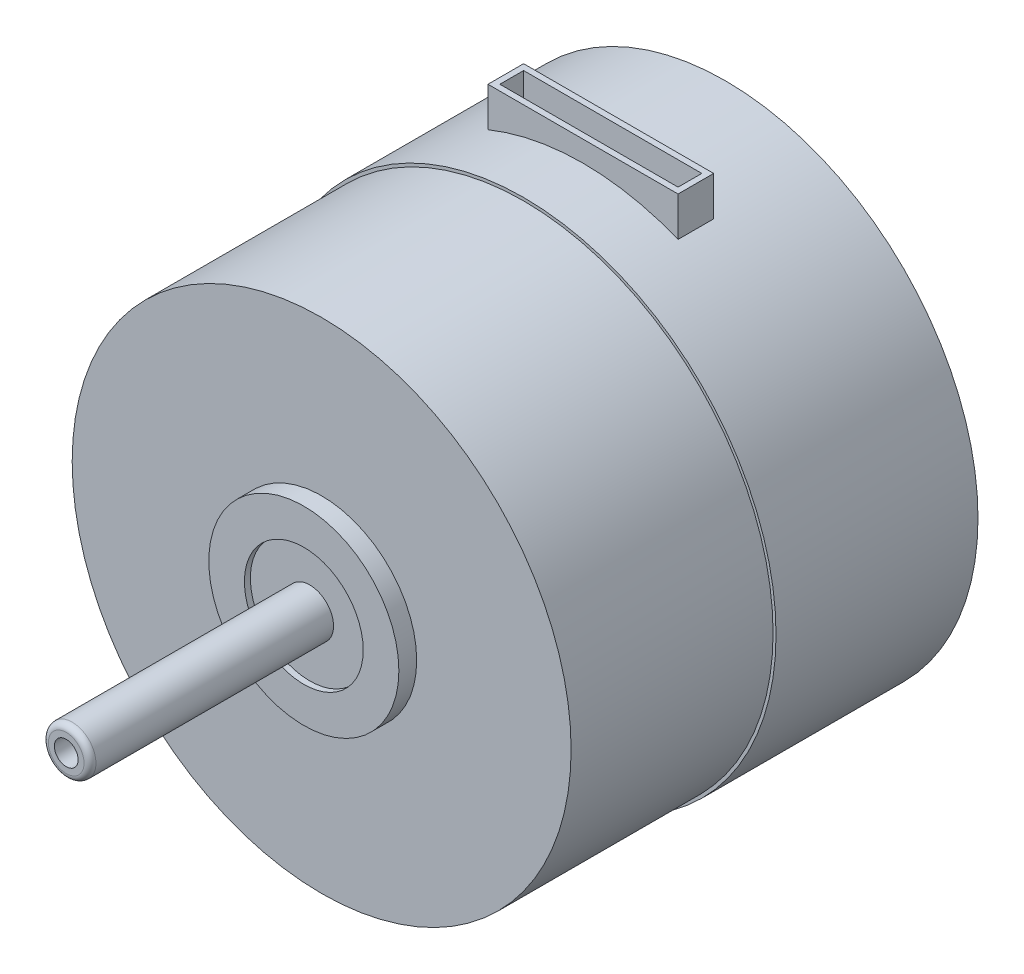
from build123d import *

# Parameters (mm, degrees)
SKETCH_1_R          = 21
EXTRUDE_1_DEPTH     = 17
SKETCH_2_R          = 8
EXTRUDE_2_DEPTH     = 1.5
SKETCH_3_R          = 3
EXTRUDE_3_DEPTH     = 20.5
CHAMFER_1_SIZE      = 1
THREAD_1_PITCH      = 1
CUT_EXTRUDE_1_DEPTH = 1
EXTRUDE1_DEPTH      = 50.020403995
EXTRUDE1_DEPTH_BACK = 50.020403995
SKETCH1_W           = 6
SKETCH1_H           = 20.5
SKETCH2_R           = 2
EXTRUDE2_DEPTH      = 20
FILLET1_R           = 0.5
SKETCH3_R           = 1
EXTRUDE3_DEPTH      = 2
FILLET2_R           = 0.5
EXTRUDE5_START      = -0.5
SKETCH4_R           = 5
SKETCH4_R_2         = 2
EXTRUDE5_DEPTH      = 0.5
SKETCH5_R           = 21.25
EXTRUDE7_DEPTH      = 17
SKETCH6_W           = 16
SKETCH6_H           = 3
EXTRUDE8_DEPTH      = 8
SKETCH7_W           = 15
SKETCH7_H           = 2
EXTRUDE9_DEPTH      = 3


with BuildPart() as part:
    # Sketch 1 → 보스-돌출1 (new body)
    with BuildSketch(Plane.XY):
        Circle(SKETCH_1_R)
    extrude(amount=EXTRUDE_1_DEPTH)

    # 스케치2 → 보스-돌출2 (add)
    with BuildSketch(Plane.XY.offset(17)):
        Circle(SKETCH_2_R)
    extrude(amount=EXTRUDE_2_DEPTH)

    # 스케치3 → 보스-돌출3 (add)
    with BuildSketch(Plane.XY.offset(18.5)):
        Circle(SKETCH_3_R)
    extrude(amount=EXTRUDE_3_DEPTH)

    # 모따기1
    chamfer_1_edges = [part.edges().sort_by_distance(p)[0] for p in [
        (-3, 0, 39),
    ]]
    chamfer(chamfer_1_edges, length=CHAMFER_1_SIZE)

    # 나사산1: the profile of Sketch 1 2 profile screwed along a right-hand helix of 8 turns, 8 arcs to a turn; built about Z, then put on its axis
    thread_1_z = Axis((0, 0, 0), (0, 0, 1))
    thread_1_corners = [(3.0003, 0, -0.000173205), (3.0003, 0, 0.875173202), (2.458734125, 0, 0.562499999), (2.458734125, 0, 0.312499999)]
    with BuildLine(mode=Mode.PRIVATE) as thread_1_profile:
        Line(thread_1_corners[0], thread_1_corners[1])
        Line(thread_1_corners[1], thread_1_corners[2])
        Line(thread_1_corners[2], thread_1_corners[3])
        Line(thread_1_corners[3], thread_1_corners[0])
    thread_1_cap = Face(thread_1_profile.wire())
    thread_1_turn_angles = [0, 22.5, 45, 67.5, 90, 112.5, 135, 157.5, 180, 202.5, 225, 247.5, 270, 292.5, 315, 337.5, 360]
    thread_1_turn_weights = [1, 0.9238795325112867, 1, 0.9238795325112867, 1, 0.9238795325112867, 1, 0.9238795325112867, 1, 0.9238795325112867, 1, 0.9238795325112867, 1, 0.9238795325112867, 1, 0.9238795325112867, 1]
    thread_1_turn_rails = [Edge.make_bspline([Vector(p[0], p[1], 0).rotate(thread_1_z, thread_1_turn_angles[k]) / thread_1_turn_weights[k] + Vector(0, 0, p[2] + THREAD_1_PITCH * thread_1_turn_angles[k] / 360) for k in range(17)], [0, 0, 0, 1, 1, 2, 2, 3, 3, 4, 4, 5, 5, 6, 6, 7, 7, 8, 8, 8], 2, thread_1_turn_weights) for p in thread_1_corners]
    thread_1_turn_sides = [Face.make_surface_from_curves(thread_1_turn_rails[p[0]], thread_1_turn_rails[p[1]]) for p in [(0, 1), (1, 2), (2, 3), (3, 0)]]
    thread_1 = Plane(origin=(0, 0, 38), x_dir=(-1, 0, 0), z_dir=(0, 0, -1)) * Solid(Shell([*[p.moved(Location((0, 0, THREAD_1_PITCH * i))) for i in range(8) for p in thread_1_turn_sides], thread_1_cap, thread_1_cap.rotate(thread_1_z, 2880).moved(Location((0, 0, THREAD_1_PITCH * 2880 / 360)))]))
    add(thread_1, mode=Mode.SUBTRACT)

    # 스케치8 → 컷-돌출1 (cut)
    with BuildSketch(Plane(origin=(0, 3, 0), x_dir=(1, 0, 0), z_dir=(0, 1, 0))):
        Polygon((3, -39), (3, -38), (3, -37.5), (3, -29.625000003), (3, -27), (-3, -27), (-3, -29.125000003), (-3, -30), (-3, -37.125000003), (-3, -38), (-3, -39), (-2, -39), (2, -39), align=None)
    extrude(amount=-CUT_EXTRUDE_1_DEPTH, mode=Mode.SUBTRACT)

    # Sketch1 → Extrude1 (cut, two sides: drawn at the far end of the back side and taken through both)
    with BuildSketch(Plane(origin=(0, 0, 0), x_dir=(1, 0, 0), z_dir=(0, 1, 0)).offset(-EXTRUDE1_DEPTH_BACK)):
        with Locations((0, -28.75)):
            Rectangle(SKETCH1_W, SKETCH1_H)
    extrude(amount=EXTRUDE1_DEPTH + EXTRUDE1_DEPTH_BACK, mode=Mode.SUBTRACT)

    # Sketch2 → Extrude2 (add)
    with BuildSketch(Plane.XY.offset(18.5)):
        Circle(SKETCH2_R)
    extrude(amount=EXTRUDE2_DEPTH)

    # Fillet1
    fillet1_edges = [part.edges().sort_by_distance(p)[0] for p in [
        (-2, 0, 38.5),
    ]]
    fillet(fillet1_edges, radius=FILLET1_R)

    # Sketch3 → Extrude3 (cut)
    with BuildSketch(Plane.XY.offset(38.5)):
        Circle(SKETCH3_R)
    extrude(amount=-EXTRUDE3_DEPTH, mode=Mode.SUBTRACT)

    # Fillet2
    fillet2_edges = [part.edges().sort_by_distance(p)[0] for p in [
        (-1, 0, 36.5),
    ]]
    fillet(fillet2_edges, radius=FILLET2_R)

    # Sketch4 → Extrude5 (cut)
    with BuildSketch(Plane.XY.offset(18.5).offset(EXTRUDE5_START)):
        Circle(SKETCH4_R)
        Circle(SKETCH4_R_2, mode=Mode.SUBTRACT)
    extrude(amount=EXTRUDE5_DEPTH, mode=Mode.SUBTRACT)

    # Sketch5 → Extrude7 (add)
    with BuildSketch(Plane(origin=(0, 0, 0), x_dir=(-1, 0, 0), z_dir=(0, 0, -1))):
        Circle(SKETCH5_R)
    extrude(amount=EXTRUDE7_DEPTH)

    # Sketch6 → Extrude8 (add)
    with BuildSketch(Plane(origin=(0, 15, 0), x_dir=(1, 0, 0), z_dir=(0, 1, 0))):
        with Locations((0, 6.5)):
            Rectangle(SKETCH6_W, SKETCH6_H)
    extrude(amount=EXTRUDE8_DEPTH)

    # Sketch7 → Extrude9 (cut)
    with BuildSketch(Plane(origin=(0, 23, 0), x_dir=(1, 0, 0), z_dir=(0, 1, 0))):
        with Locations((0, 6.5)):
            Rectangle(SKETCH7_W, SKETCH7_H)
    extrude(amount=-EXTRUDE9_DEPTH, mode=Mode.SUBTRACT)


solid = part.part
